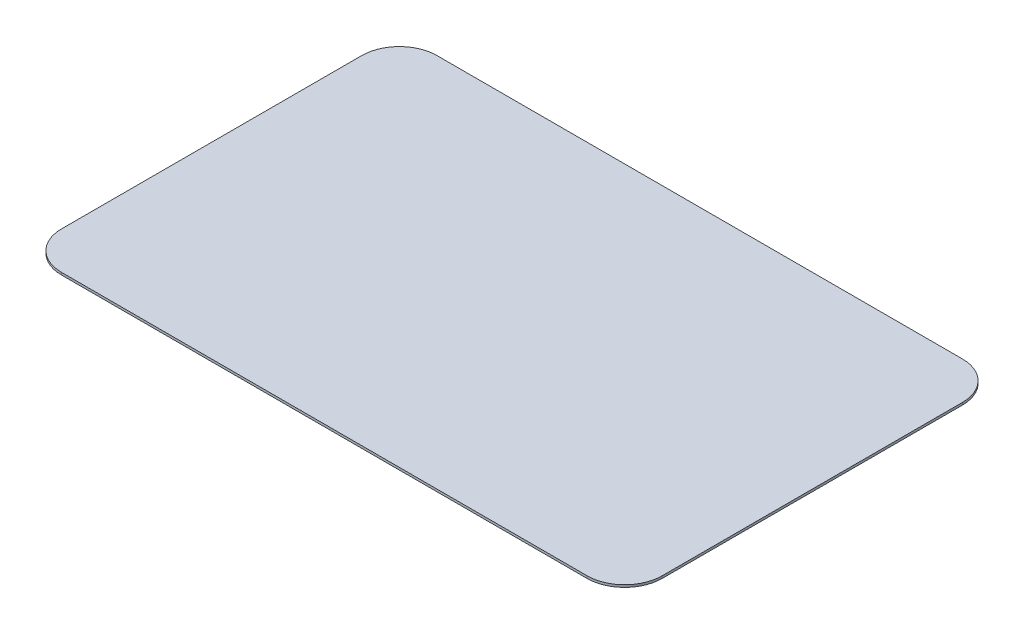
from build123d import *

# Parameters (mm, degrees)
MAINBODY_DEPTH = 0.79375


with BuildPart() as part:
    # Sketch1 → MainBody (new body)
    with BuildSketch(Plane(origin=(0, 25.327496354, 0), x_dir=(1, 0, 0), z_dir=(0, 1, 0))):
        with BuildLine():
            Line((98.380806561, -36.565564287), (98.380806561, 65.034435713))
            ThreePointArc((98.380806561, 65.034435713), (94.661062682, 74.014691834), (85.680806561, 77.734435713))
            Line((85.680806561, 77.734435713), (-92.119193439, 77.734435713))
            ThreePointArc((-92.119193439, 77.734435713), (-101.09944956, 74.014691834), (-104.819193439, 65.034435713))
            Line((-104.819193439, 65.034435713), (-104.819193439, -36.565564287))
            ThreePointArc((-104.819193439, -36.565564287), (-101.09944956, -45.545820408), (-92.119193439, -49.265564287))
            Line((-92.119193439, -49.265564287), (85.680806561, -49.265564287))
            ThreePointArc((85.680806561, -49.265564287), (94.661062682, -45.545820408), (98.380806561, -36.565564287))
        make_face()
    extrude(amount=MAINBODY_DEPTH)


solid = part.part
